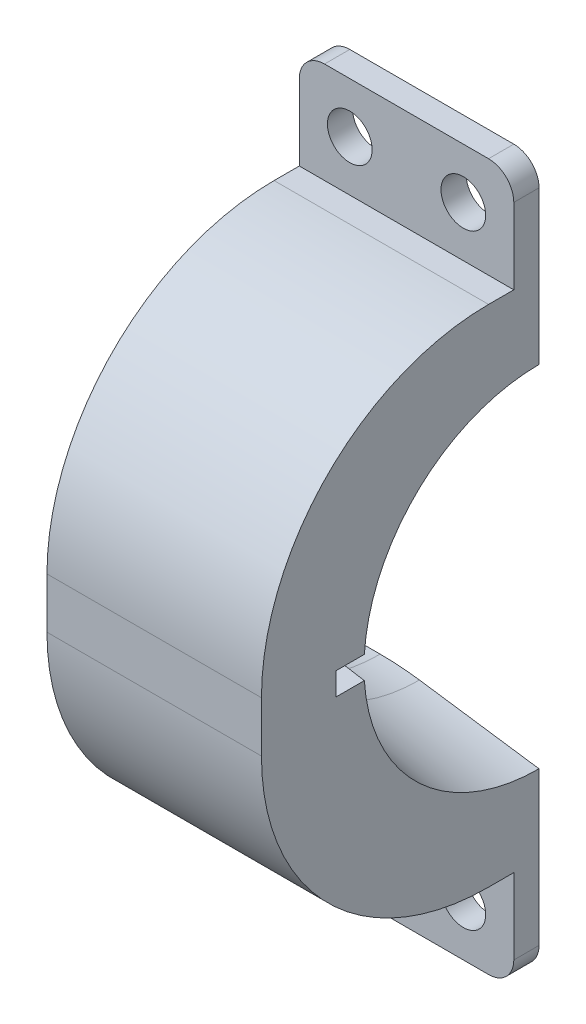
from build123d import *

# Parameters (mm, degrees)
SKETCH3_W           = 93.98
SKETCH3_H           = 50.8
BOSS_EXTRUDE1_DEPTH = 27.94
SKETCH4_W           = 72.39
SKETCH4_H           = 50.8
CUT_EXTRUDE1_DEPTH  = 27.94
FILLET1_R           = 22.86
SKETCH5_W           = 21.59
SKETCH5_H           = 10.16
BOSS_EXTRUDE2_DEPTH = 2.54
FILLET2_R           = 2.54
SKETCH6_R           = 2.249999945
CUT_EXTRUDE2_DEPTH  = 2.54
SKETCH7_W           = 3.81
SKETCH7_H           = 2.286
CUT_EXTRUDE3_DEPTH  = 7.62
SKETCH8_R           = 15.621
CUT_EXTRUDE4_DEPTH  = 15.24
FILLET3_R           = 27.94


# Read off the part's stored shape, not the designer's step: Cavity1
with BuildPart() as part:
    # Sketch3 → Boss-Extrude1 (new body)
    with BuildSketch(Plane.XY):
        with Locations((-42.520322955, 0)):
            Rectangle(SKETCH3_W, SKETCH3_H)
    extrude(amount=BOSS_EXTRUDE1_DEPTH)

    # Cavity1 outline → Cavity1 (revolve, cut)
    with BuildSketch(Plane.YX):
        with BuildLine():
            Line((0, -89.510322955), (14.536498149, -89.510322955))
            Line((14.536498149, -89.510322955), (17.81175, -66.58356))
            Line((17.81175, -66.58356), (6.477, -66.58356))
            Line((6.477, -66.58356), (6.477, -17.35836))
            Line((6.477, -17.35836), (23.05812, -17.35836))
            ThreePointArc((23.05812, -17.35836), (21.288451872, -10.075162449), (18.689240956, -3.045169955))
            ThreePointArc((18.689240956, -3.045169955), (17.939550019, -2.064315438), (16.821043187, -1.541769218))
            ThreePointArc((16.821043187, -1.541769218), (11.026301594, -0.582300423), (5.1816, 0))
            Line((5.1816, 0), (4.864997876, 4.469677045))
            Line((4.864997876, 4.469677045), (0, 4.469677045))
            Line((0, 4.469677045), (0, -89.510322955))
        make_face()
    revolve(axis=Axis((0, 0, 0), (1, 0, 0)), mode=Mode.SUBTRACT)

    # Sketch4 → Cut-Extrude1 (cut)
    with BuildSketch(Plane(origin=(0, 0, 0), x_dir=(-1, 0, 0), z_dir=(0, 0, -1))):
        with Locations((31.725322955, 0)):
            Rectangle(SKETCH4_W, SKETCH4_H)
    extrude(amount=-CUT_EXTRUDE1_DEPTH, mode=Mode.SUBTRACT)

    # Fillet1
    fillet1_edges = [part.edges().sort_by_distance(p)[0] for p in [
        (-78.715322955, 25.4, 27.94),
        (-78.715322955, -25.4, 27.94),
    ]]
    fillet(fillet1_edges, radius=FILLET1_R)

    # Sketch5 → Boss-Extrude2 (add)
    with BuildSketch(Plane(origin=(0, 0, 0), x_dir=(-1, 0, 0), z_dir=(0, 0, -1))):
        with Locations((78.715322955, 30.48)):
            Rectangle(SKETCH5_W, SKETCH5_H)
        with Locations((78.715322955, -30.48)):
            Rectangle(SKETCH5_W, SKETCH5_H)
    extrude(amount=-BOSS_EXTRUDE2_DEPTH)

    # Fillet2
    fillet2_edges = [part.edges().sort_by_distance(p)[0] for p in [
        (-89.510322955, 35.56, 1.27),
        (-67.920322955, 35.56, 1.27),
        (-89.510322955, -35.56, 1.27),
        (-67.920322955, -35.56, 1.27),
    ]]
    fillet(fillet2_edges, radius=FILLET2_R)

    # Sketch6 → Cut-Extrude2 (cut)
    with BuildSketch(Plane.XY.offset(2.54)):
        with Locations((-84.430322955, 30.48)):
            Circle(SKETCH6_R)
        with Locations((-73.000322955, 30.48)):
            Circle(SKETCH6_R)
        with Locations((-84.430322955, -30.48)):
            Circle(SKETCH6_R)
        with Locations((-73.000322955, -30.48)):
            Circle(SKETCH6_R)
    extrude(amount=-CUT_EXTRUDE2_DEPTH, mode=Mode.SUBTRACT)

    # Sketch7 → Cut-Extrude3 (cut)
    with BuildSketch(Plane(origin=(-67.920322955, 0, 0), x_dir=(0, 0, -1), z_dir=(1, 0, 0))):
        with Locations((-18.509783864, 0)):
            Rectangle(SKETCH7_W, SKETCH7_H)
    extrude(amount=-CUT_EXTRUDE3_DEPTH, mode=Mode.SUBTRACT)

    # Sketch8 → Cut-Extrude4 (cut)
    with BuildSketch(Plane.ZY.offset(89.510322955)):
        Circle(SKETCH8_R)
    extrude(amount=-CUT_EXTRUDE4_DEPTH, mode=Mode.SUBTRACT)

    # Fillet3
    fillet3_edges = [part.edges().sort_by_distance(p)[0] for p in [
        (-81.918809999, 0, 15.621),
    ]]
    fillet(fillet3_edges, radius=FILLET3_R)


solid = part.part
